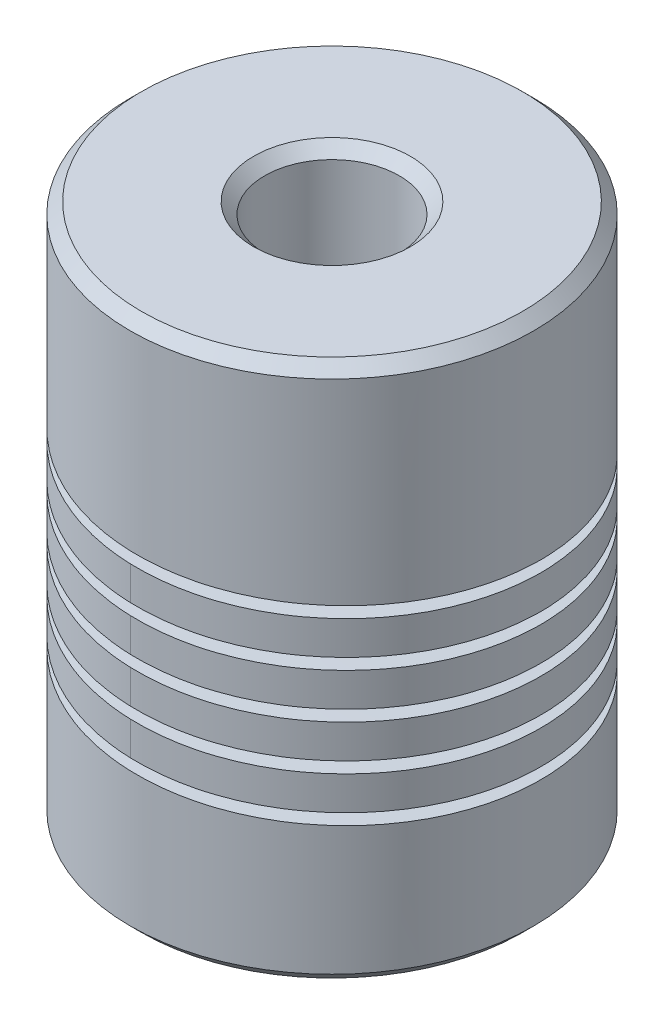
from build123d import *

# Parameters (mm, degrees)
SKETCH1_R           = 9
BOSS_EXTRUDE1_DEPTH = 24
SKETCH2_R           = 3
CUT_EXTRUDE1_DEPTH  = 28.166155414
SKETCH3_R           = 4
CUT_EXTRUDE2_DEPTH  = 16
CHAMFER1_SIZE       = 0.5
CUT_SWEEP2_PITCH    = 2


with BuildPart() as part:
    # Sketch1 → Boss-Extrude1 (new body)
    with BuildSketch(Plane(origin=(0, 0, 0), x_dir=(1, 0, 0), z_dir=(0, 1, 0))):
        with Locations(Location((0, 0, 0), (0, 0, 270))):
            Circle(SKETCH1_R)
    extrude(amount=BOSS_EXTRUDE1_DEPTH)

    # Sketch2 → Cut-Extrude1 (cut, through all)
    with BuildSketch(Plane(origin=(0, 24, 0), x_dir=(1, 0, 0), z_dir=(0, 1, 0))):
        with Locations(Location((0, 0, 0), (0, 0, 270))):
            Circle(SKETCH2_R)
    extrude(amount=-CUT_EXTRUDE1_DEPTH, mode=Mode.SUBTRACT)

    # Sketch3 → Cut-Extrude2 (cut)
    with BuildSketch(Plane.XZ):
        with Locations(Location((0, 0, 0), (0, 0, 270))):
            Circle(SKETCH3_R)
    extrude(amount=-CUT_EXTRUDE2_DEPTH, mode=Mode.SUBTRACT)

    # Chamfer1
    chamfer1_edges = [part.edges().sort_by_distance(p)[0] for p in [
        (0, 0, 4),
        (0, 0, -9),
        (0, 24, -9),
        (0, 24, -3),
    ]]
    chamfer(chamfer1_edges, length=CHAMFER1_SIZE)

    # Cut-Sweep2: the profile of Sketch8 profile screwed along a left-hand helix of 5 turns, 10 arcs to a turn; built about Z, then put on its axis
    cut_sweep2_z = Axis((0, 0, 0), (0, 0, 1))
    cut_sweep2_corners = [(9, 0, 0), (3.9997, 0, 0), (3.9997, 0, 0.5), (9, 0, 0.5)]
    with BuildLine(mode=Mode.PRIVATE) as cut_sweep2_profile:
        Line(cut_sweep2_corners[0], cut_sweep2_corners[1])
        Line(cut_sweep2_corners[1], cut_sweep2_corners[2])
        Line(cut_sweep2_corners[2], cut_sweep2_corners[3])
        Line(cut_sweep2_corners[3], cut_sweep2_corners[0])
    cut_sweep2_cap = Face(cut_sweep2_profile.wire())
    cut_sweep2_turn_angles = [0, -18, -36, -54, -72, -90, -108, -126, -144, -162, -180, -198, -216, -234, -252, -270, -288, -306, -324, -342, -360]
    cut_sweep2_turn_weights = [1, 0.9510565162951535, 1, 0.9510565162951535, 1, 0.9510565162951535, 1, 0.9510565162951535, 1, 0.9510565162951535, 1, 0.9510565162951535, 1, 0.9510565162951535, 1, 0.9510565162951535, 1, 0.9510565162951535, 1, 0.9510565162951535, 1]
    cut_sweep2_turn_rails = [Edge.make_bspline([Vector(p[0], p[1], 0).rotate(cut_sweep2_z, cut_sweep2_turn_angles[k]) / cut_sweep2_turn_weights[k] + Vector(0, 0, p[2] + -CUT_SWEEP2_PITCH * cut_sweep2_turn_angles[k] / 360) for k in range(21)], [0, 0, 0, 1, 1, 2, 2, 3, 3, 4, 4, 5, 5, 6, 6, 7, 7, 8, 8, 9, 9, 10, 10, 10], 2, cut_sweep2_turn_weights) for p in cut_sweep2_corners]
    cut_sweep2_turn_sides = [Face.make_surface_from_curves(cut_sweep2_turn_rails[p[0]], cut_sweep2_turn_rails[p[1]]) for p in [(0, 1), (1, 2), (2, 3), (3, 0)]]
    cut_sweep2 = Plane(origin=(0, 16, 0), x_dir=(0, 0, -1), z_dir=(0, -1, 0)) * Solid(Shell([*[p.moved(Location((0, 0, CUT_SWEEP2_PITCH * i))) for i in range(5) for p in cut_sweep2_turn_sides], cut_sweep2_cap, cut_sweep2_cap.rotate(cut_sweep2_z, -1800).moved(Location((0, 0, -CUT_SWEEP2_PITCH * -1800 / 360)))]))
    add(cut_sweep2, mode=Mode.SUBTRACT)


solid = part.part
